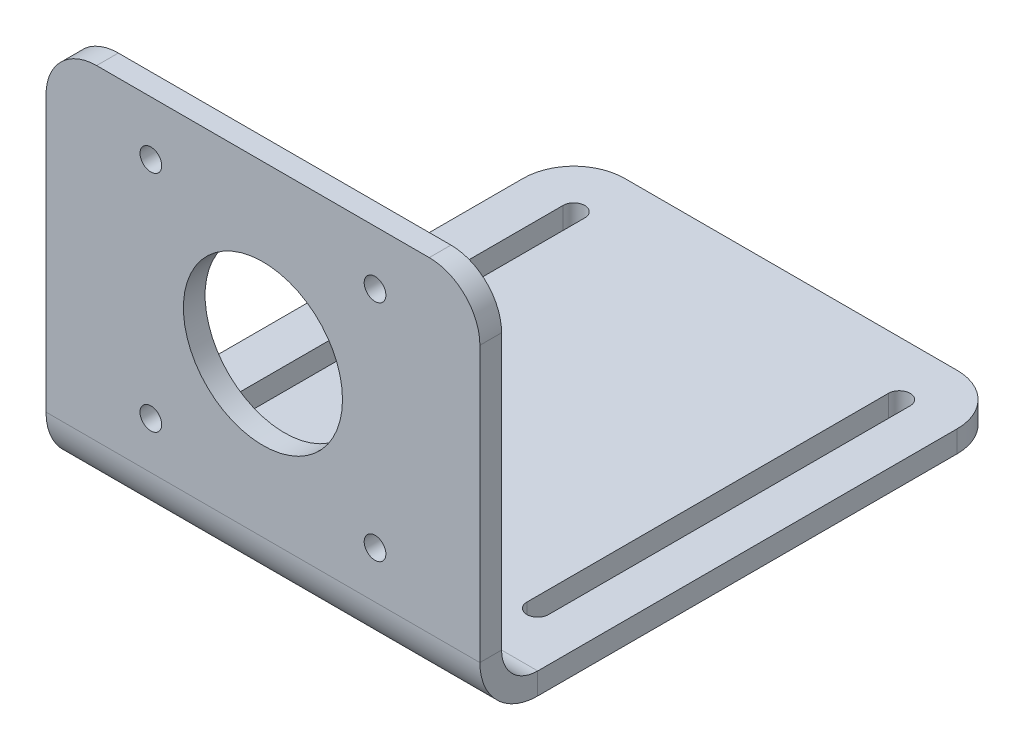
from build123d import *

# Parameters (mm, degrees)
BASE_FLANGE1_DEPTH = 60
SKETCH6_R          = 11
SKETCH6_R_2        = 1.5
CUT_EXTRUDE1_DEPTH = 10
CUT_EXTRUDE2_DEPTH = 3
FILLET1_R          = 7


# Read off the part's stored shape, not the designer's step: Base-Flange1
with BuildPart() as part:
    # Base-Flange1 outline → Base-Flange1 (new body)
    with BuildSketch(Plane(origin=(0, 0, 0), x_dir=(0, 0, -1), z_dir=(1, 0, 0))):
        with BuildLine():
            Line((5, -3), (70, -3))
            Line((70, -3), (70, 0))
            Line((70, 0), (5, 0))
            ThreePointArc((5, 0), (1.464466094, 1.464466094), (0, 5))
            Line((0, 5), (0, 50))
            Line((0, 50), (-3, 50))
            Line((-3, 50), (-3, 5))
            ThreePointArc((-3, 5), (-0.656854249, -0.656854249), (5, -3))
        make_face()
    extrude(amount=BASE_FLANGE1_DEPTH)

    # Sketch6 → Cut-Extrude1 (cut)
    with BuildSketch(Plane.XY.offset(3)):
        with Locations((30, 27)):
            Circle(SKETCH6_R)
        with Locations((45.5, 42.5)):
            Circle(SKETCH6_R_2)
        with Locations(Location((14.5, 42.5, 0), (0, 0, 180))):
            Circle(SKETCH6_R_2)
        with Locations((14.5, 11.5)):
            Circle(SKETCH6_R_2)
        with Locations(Location((45.5, 11.5, 0), (0, 0, 180))):
            Circle(SKETCH6_R_2)
    extrude(amount=-CUT_EXTRUDE1_DEPTH, mode=Mode.SUBTRACT)

    # Sketch7 → Cut-Extrude2 (cut)
    with BuildSketch(Plane.XZ.offset(3)):
        with BuildLine():
            Line((6, -62.5), (6, -12.5))
            ThreePointArc((6, -12.5), (7.5, -11), (9, -12.5))
            Line((9, -12.5), (9, -62.5))
            ThreePointArc((9, -62.5), (7.5, -64), (6, -62.5))
        make_face()
        with BuildLine():
            Line((54, -62.5), (54, -12.5))
            ThreePointArc((54, -12.5), (52.5, -11), (51, -12.5))
            Line((51, -12.5), (51, -62.5))
            ThreePointArc((51, -62.5), (52.5, -64), (54, -62.5))
        make_face()
    extrude(amount=-CUT_EXTRUDE2_DEPTH, mode=Mode.SUBTRACT)

    # Fillet1
    fillet1_edges = [part.edges().sort_by_distance(p)[0] for p in [
        (60, 50, 1.5),
        (60, -1.5, -70),
        (0, 50, 1.5),
        (0, -1.5, -70),
    ]]
    fillet(fillet1_edges, radius=FILLET1_R)


solid = part.part
